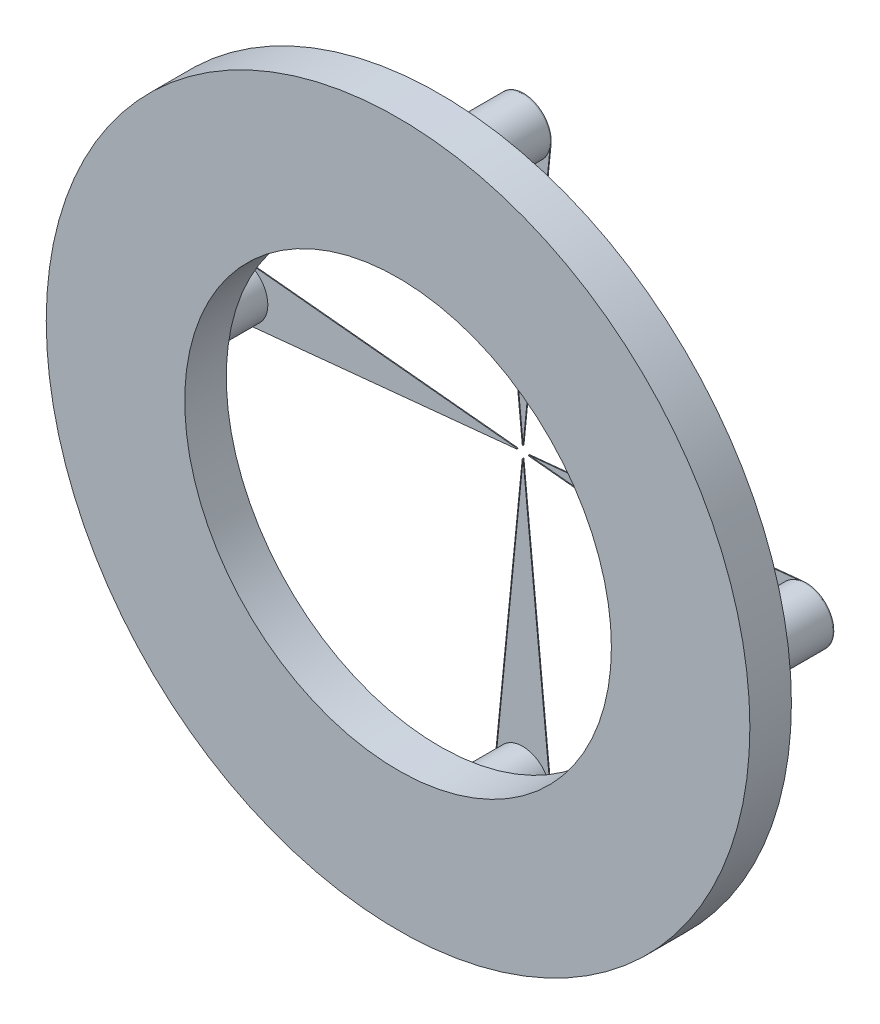
from build123d import *

# Parameters (mm, degrees)
SKETCH_1_R      = 25.405
SKETCH_1_R_2    = 15.405
EXTRUDE_3_DEPTH = 3
SKETCH_4_R      = 2
EXTRUDE_4_DEPTH = 6
EXTRUDE_7_DEPTH = 0.06


# Read off the part's stored shape, not the designer's step: 填料-伸長7
with BuildPart() as part:
    # 草圖1 → 填料-伸長3 (new body)
    with BuildSketch(Plane.XY):
        Circle(SKETCH_1_R)
        Circle(SKETCH_1_R_2, mode=Mode.SUBTRACT)
    extrude(amount=EXTRUDE_3_DEPTH)

    # 草圖4 → 填料-伸長4 (add)
    with BuildSketch(Plane(origin=(0, 0, 0), x_dir=(-1, 0, 0), z_dir=(0, 0, -1))):
        with Locations(Location((20.405, 0, 0), (0, 0, 180))):
            Circle(SKETCH_4_R)
        with Locations(Location((0, 20.405, 0), (0, 0, 180))):
            Circle(SKETCH_4_R)
        with Locations(Location((-20.405, 0, 0), (0, 0, 180))):
            Circle(SKETCH_4_R)
        with Locations(Location((0, -20.405, 0), (0, 0, 180))):
            Circle(SKETCH_4_R)
    extrude(amount=EXTRUDE_4_DEPTH)

    # 填料-伸長7 outline → 填料-伸長7 (add)
    with BuildSketch(Plane(origin=(0, 0, -6), x_dir=(-1, 0, 0), z_dir=(0, 0, -1))):
        with BuildLine():
            Line((-0.435027571, 0.029718439), (-20.160544311, 1.985568742))
            ThreePointArc((-20.160544311, 1.985568742), (-22.405419947, 0.023703335), (-20.207661062, -1.990803646))
            Line((-20.207661062, -1.990803646), (-0.435027571, -0.030281561))
            ThreePointArc((-0.435027571, -0.030281561), (-0.405027571, -0.000281561), (-0.435027571, 0.029718439))
        make_face()
        with BuildLine():
            ThreePointArc((1.985568742, 20.160544311), (0.023703335, 22.405419947), (-1.990803646, 20.207661062))
            Line((-1.990803646, 20.207661062), (-0.030281561, 0.435027571))
            ThreePointArc((-0.030281561, 0.435027571), (-0.000281561, 0.405027571), (0.029718439, 0.435027571))
            Line((0.029718439, 0.435027571), (1.985568742, 20.160544311))
        make_face()
        with BuildLine():
            ThreePointArc((20.160544311, -1.985568742), (22.405419947, -0.023703335), (20.207661062, 1.990803646))
            Line((20.207661062, 1.990803646), (0.435027571, 0.030281561))
            ThreePointArc((0.435027571, 0.030281561), (0.405027571, 0.000281561), (0.435027571, -0.029718439))
            Line((0.435027571, -0.029718439), (20.160544311, -1.985568742))
        make_face()
        with BuildLine():
            ThreePointArc((-1.985568742, -20.160544311), (-0.023703335, -22.405419947), (1.990803646, -20.207661062))
            Line((1.990803646, -20.207661062), (0.030281561, -0.435027571))
            ThreePointArc((0.030281561, -0.435027571), (0.000281561, -0.405027571), (-0.029718439, -0.435027571))
            Line((-0.029718439, -0.435027571), (-1.985568742, -20.160544311))
        make_face()
    extrude(amount=EXTRUDE_7_DEPTH)


solid = part.part
